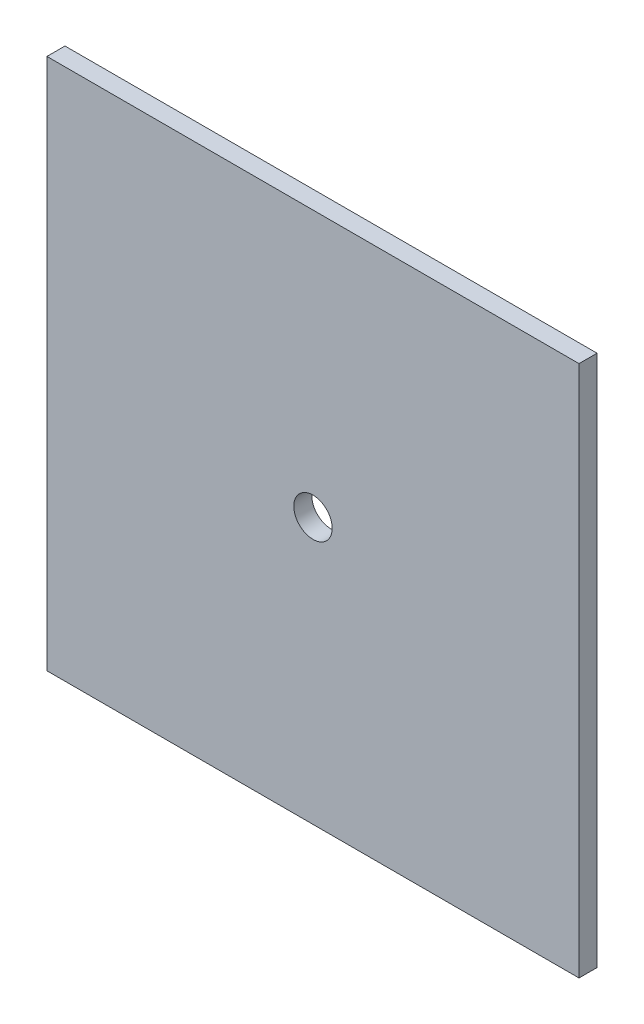
from build123d import *

# Parameters (mm, degrees)
SKETCH1_W                   = 93.649999898
SKETCH1_H                   = 93.649999898
BOSS_EXTRUDE1_DEPTH         = 3.175
F_1_4_CLEARANCE_HOLE1_D     = 6.7564
F_1_4_CLEARANCE_HOLE1_DEPTH = 4.826
F_1_4_CLEARANCE_HOLE1_TIP   = 2.029827343


with BuildPart() as part:
    # Sketch1 → Boss-Extrude1 (new body)
    with BuildSketch(Plane.XY):
        Rectangle(SKETCH1_W, SKETCH1_H)
    extrude(amount=BOSS_EXTRUDE1_DEPTH)

    # 1/4 Clearance Hole1
    with Locations(Plane.XY.offset(3.175)):
        with Locations((0, 0)):
            Hole(F_1_4_CLEARANCE_HOLE1_D / 2, depth=F_1_4_CLEARANCE_HOLE1_DEPTH)
            with Locations((0, 0, -(F_1_4_CLEARANCE_HOLE1_DEPTH + F_1_4_CLEARANCE_HOLE1_TIP / 2))):  # 118° drill point
                Cone(0, F_1_4_CLEARANCE_HOLE1_D / 2, F_1_4_CLEARANCE_HOLE1_TIP, mode=Mode.SUBTRACT)


solid = part.part
